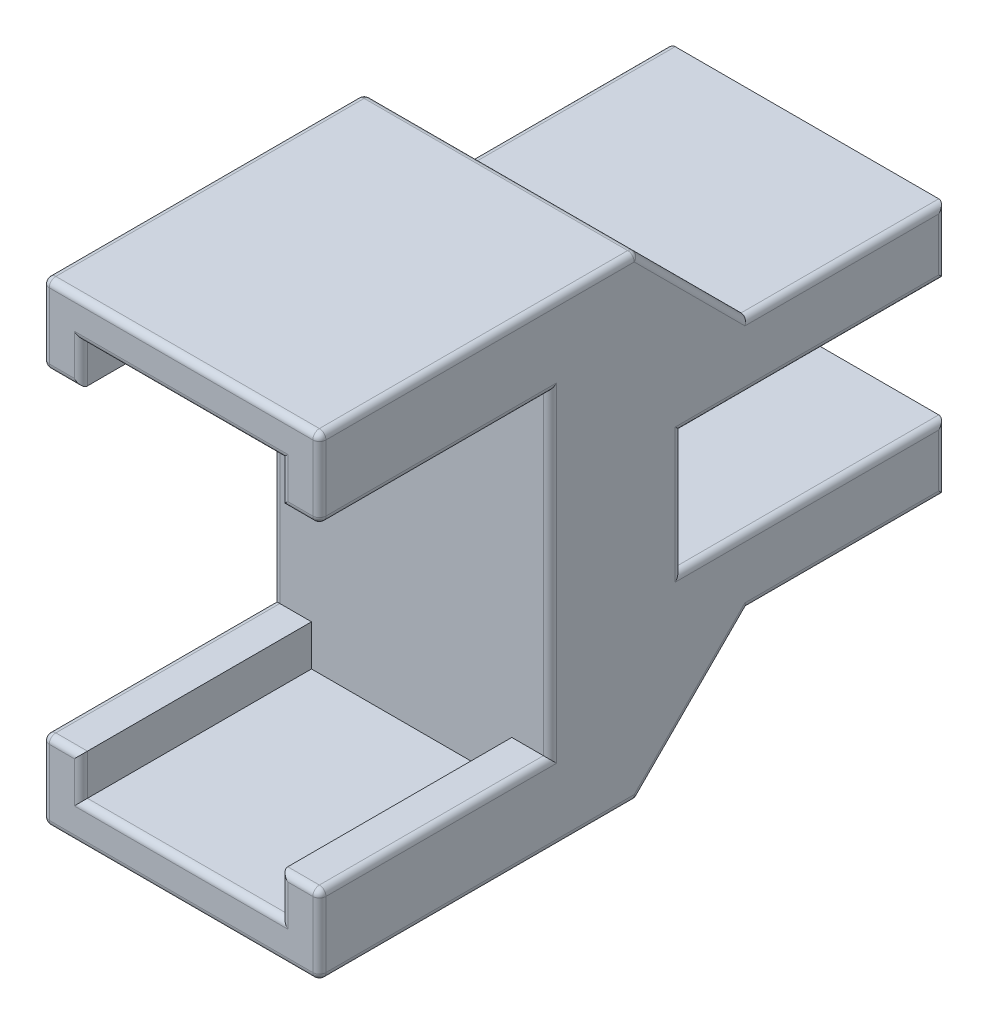
from build123d import *

# Parameters (mm, degrees)
BOSS_EXTRUDE1_DEPTH = 21
SKETCH2_W           = 42
SKETCH2_H           = 72
BOSS_EXTRUDE2_DEPTH = 10
BOSS_EXTRUDE3_DEPTH = 35
CHAMFER1_SIZE       = 20
FILLET1_R           = 1


with BuildPart() as part:
    # Sketch1 → Boss-Extrude1 (new, symmetric)
    with BuildSketch(Plane(origin=(0, 0, 0), x_dir=(0, 0, -1), z_dir=(1, 0, 0))):
        Polygon((0, -9.2), (0, 9.2), (40, 9.2), (40, 19.2), (-10, 19.2), (-10, -19.2), (40, -19.2), (40, -9.2), align=None)
    extrude(amount=BOSS_EXTRUDE1_DEPTH, both=True)

    # Sketch2 → Boss-Extrude2 (add)
    with BuildSketch(Plane.XY.offset(10)):
        Rectangle(SKETCH2_W, SKETCH2_H)
    extrude(amount=BOSS_EXTRUDE2_DEPTH)

    # Sketch3 → Boss-Extrude3 (add)
    with BuildSketch(Plane.XY.offset(20)):
        Polygon((-15.2, 30.2), (-15.2, 24), (-21, 24), (-21, 36), (21, 36), (21, 24), (15.2, 24), (15.2, 30.2), align=None)
        Polygon((-15.2, -30.2), (15.2, -30.2), (15.2, -24), (21, -24), (21, -36), (-21, -36), (-21, -24), (-15.2, -24), align=None)
    extrude(amount=BOSS_EXTRUDE3_DEPTH)

    # Chamfer1
    # the kernel refuses this chamfer: 20 mm, written as the material it adds along each edge
    with BuildSketch(Plane(origin=(-21, -19.2, 10), x_dir=(0, 0.027495876610586317, -0.9996219169112968), z_dir=(1, 0, 0))) as chamfer1_piece_1_section:
        Polygon((CHAMFER1_SIZE * 0.999621916911, -CHAMFER1_SIZE * 0.0274958766106), (-CHAMFER1_SIZE * 0.0274958766106, -CHAMFER1_SIZE * 0.999621916911), (0, 0), align=None)
    chamfer1_piece_1 = extrude(amount=42, mode=Mode.PRIVATE)
    chamfer1_piece_1 = split(chamfer1_piece_1, bisect_by=Plane(origin=(0, -36, 3.17327651), z_dir=(0, 1, 0)), keep=Keep.TOP, mode=Mode.PRIVATE)
    add(chamfer1_piece_1)
    with BuildSketch(Plane(origin=(-21, 19.2, 10), x_dir=(0, 0.9996219169112968, 0.027495876610586403), z_dir=(1, 0, 0))) as chamfer1_piece_2_section:
        Polygon((CHAMFER1_SIZE * 0.999621916911, -CHAMFER1_SIZE * 0.0274958766106), (-CHAMFER1_SIZE * 0.0274958766106, -CHAMFER1_SIZE * 0.999621916911), (0, 0), align=None)
    chamfer1_piece_2 = extrude(amount=42, mode=Mode.PRIVATE)
    chamfer1_piece_2 = split(chamfer1_piece_2, bisect_by=Plane(origin=(0, 36, 3.17327651), z_dir=(0, -1, 0)), keep=Keep.TOP, mode=Mode.PRIVATE)
    add(chamfer1_piece_2)

    # Fillet1
    fillet1_edges = [part.edges().sort_by_distance(p)[0] for p in [
        (-21, 19.2, -25),
        (-21, 14.2, -40),
        (21, -14.2, -40),
        (21, -9.2, -20),
        (-21, 36, 30.9),
        (-21, -36, 30.9),
        (21, -36, 30.9),
        (21, 36, 30.9),
        (21, 0, 0),
        (21, 9.2, -20),
        (-21, 0, 20),
        (21, 24, 37.5),
        (-21, 24, 37.5),
        (0, 30.2, 55),
        (15.2, 27.1, 55),
        (18.1, 24, 55),
        (21, 30, 55),
        (0, 36, 55),
        (-21, 30, 55),
        (-18.1, 24, 55),
        (-15.2, 27.1, 55),
        (21, 14.2, -40),
        (21, 0, 20),
        (-21, -24, 37.5),
        (21, -24, 37.5),
        (-15.2, -27.1, 55),
        (-18.1, -24, 55),
        (-21, -30, 55),
        (0, -36, 55),
        (21, -30, 55),
        (18.1, -24, 55),
        (15.2, -27.1, 55),
        (0, -30.2, 55),
        (-21, -19.2, -25),
        (21, -19.2, -25),
        (-21, -27.6, -1.6),
        (0, -36, 6.8),
        (21, -27.6, -1.6),
        (-21, 9.2, -20),
        (0, 36, 6.8),
        (-21, 27.6, -1.6),
        (21, 27.6, -1.6),
        (21, 19.2, -25),
        (-21, 0, 0),
        (-21, -9.2, -20),
        (-21, -14.2, -40),
    ]]
    fillet(fillet1_edges, radius=FILLET1_R)


solid = part.part
